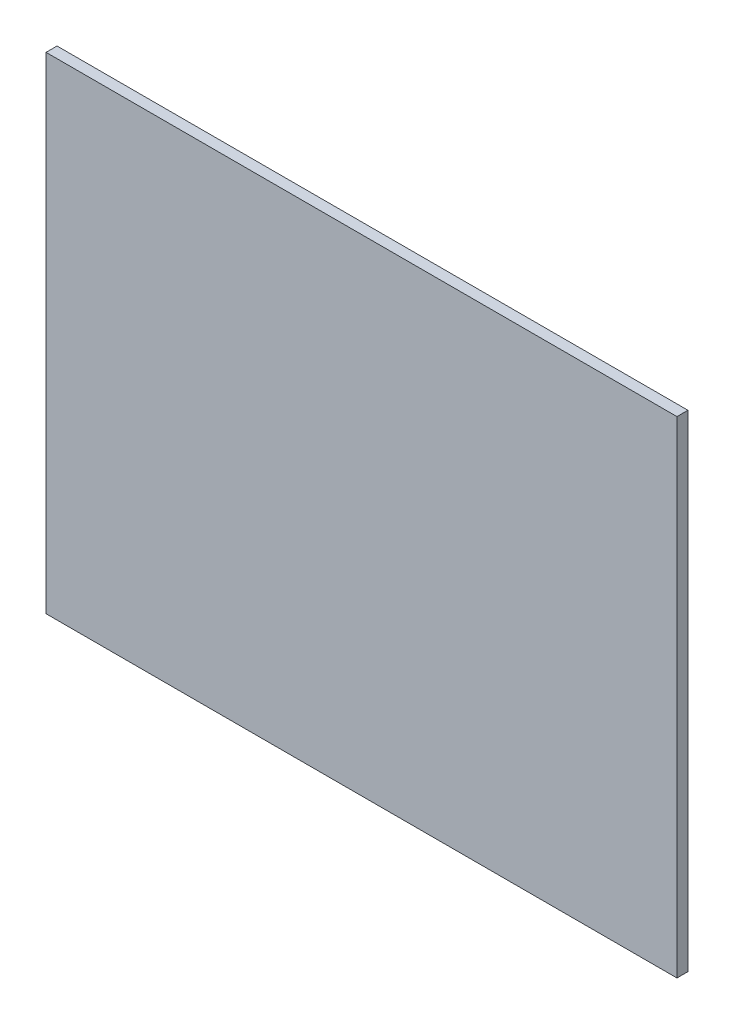
from build123d import *

# Parameters (mm, degrees)
SKETCH1_W          = 109
SKETCH1_H          = 84
BASE_FLANGE1_DEPTH = 1.89738


# Sheet-metal steps are written as plain solids
with BuildPart() as part:
    # Sketch1 → Base-Flange1 (new body)
    with BuildSketch(Plane.XY):
        with Locations((5.273078002, -1.850029648)):
            Rectangle(SKETCH1_W, SKETCH1_H)
    extrude(amount=-BASE_FLANGE1_DEPTH)


solid = part.part
